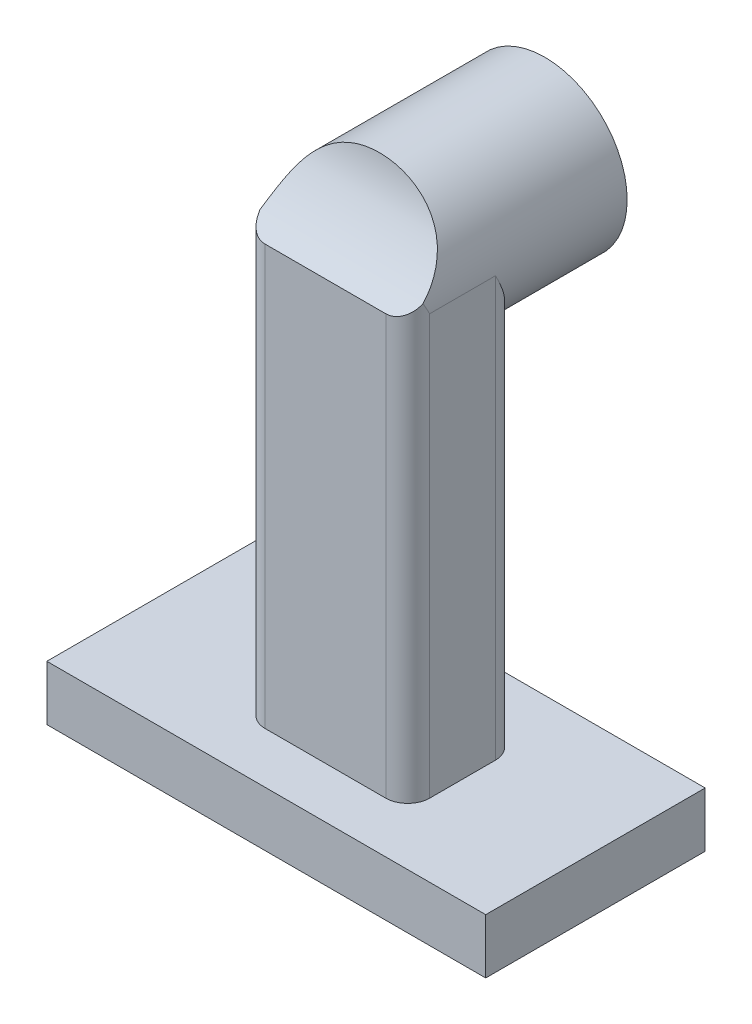
from build123d import *

# Parameters (mm, degrees)
IZIM1_R                          = 7.5
Y_KSEKLIK_EKSTR_ZYON1_DEPTH      = 15
Y_KSEKLIK_EKSTR_ZYON2_DEPTH      = 5
Y_KSEKLIK_EKSTR_ZYON2_DEPTH_BACK = 5
IZIM2_W                          = 15
IZIM2_H                          = 38.236646402
RADYUS1_R                        = 10
RADYUS2_R                        = 2
IZIM3_R                          = 3.5
KES_EKSTR_ZYON1_DEPTH            = 10
IZIM4_W                          = 40
IZIM4_H                          = 20
Y_KSEKLIK_EKSTR_ZYON3_DEPTH      = 5


with BuildPart() as part:
    # Çizim1 → Yükseklik-Ekstrüzyon1 (new body)
    with BuildSketch(Plane.XY):
        with Locations((0, 31.714285714)):
            Circle(IZIM1_R)
    extrude(amount=Y_KSEKLIK_EKSTR_ZYON1_DEPTH)

    # Çizim2 → Yükseklik-Ekstrüzyon2 (add, two sides: drawn at the far end of the back side and taken through both)
    with BuildSketch(Plane.XY.offset(15).offset(-Y_KSEKLIK_EKSTR_ZYON2_DEPTH_BACK)):
        with Locations((0, 12.595962513)):
            Rectangle(IZIM2_W, IZIM2_H)
    extrude(amount=Y_KSEKLIK_EKSTR_ZYON2_DEPTH + Y_KSEKLIK_EKSTR_ZYON2_DEPTH_BACK)

    # Radyus1
    # the kernel refuses this fillet: 10 mm, written as the material it adds along each edge
    with BuildSketch(Plane(origin=(29.150635095, 31.714285714, 15), x_dir=(0, 1, 0), z_dir=(-1, 0, 0))) as radyus1_piece_1_section:
        with BuildLine():
            CenterArc((8.660254038, -10), RADYUS1_R, 90, 60)
            Line((0, -5), (0, 0))
            Line((0, 0), (8.660254038, 0))
        make_face()
    radyus1_piece_1 = extrude(amount=58.301270189, mode=Mode.PRIVATE)
    radyus1_piece_1 = radyus1_piece_1 & Plane(origin=(0, 31.714285714, 15), x_dir=(1, 0, 0), z_dir=(0, 0, -1)) * Cylinder(7.5, 152, mode=Mode.PRIVATE)
    add(radyus1_piece_1)

    # Radyus2
    # the kernel refuses this fillet: 2 mm, written as the material it takes off along each edge
    with BuildSketch(Plane(origin=(-7.5, -11.522360688, 10), x_dir=(0, 0, 1), z_dir=(0, 1, 0))) as radyus2_piece_1_section:
        with BuildLine():
            CenterArc((RADYUS2_R, RADYUS2_R), RADYUS2_R, 180, 90)
            Line((0, RADYUS2_R), (0, 0))
            Line((0, 0), (RADYUS2_R, 0))
        make_face()
    radyus2_piece_1 = extrude(amount=51.736646403, mode=Mode.PRIVATE)
    radyus2_piece_1 = radyus2_piece_1 - Plane(origin=(0, 31.714285714, 10), x_dir=(1, 0, 0), z_dir=(0, 0, -1)) * Cylinder(7.5, 112, mode=Mode.PRIVATE)
    add(radyus2_piece_1, mode=Mode.SUBTRACT)
    with BuildSketch(Plane(origin=(-7.5, -11.522360688, 20), x_dir=(0, 0, -1), z_dir=(0, 1, 0)), Plane(origin=(7.5, 40.214285714, 20), x_dir=(0, 0, -1), z_dir=(0, -1, 0))) as radyus2_piece_2:
        with BuildLine():
            CenterArc((RADYUS2_R, -RADYUS2_R), RADYUS2_R, 90, 90)
            Line((0, -RADYUS2_R), (0, 0))
            Line((0, 0), (RADYUS2_R, 0))
        make_face()
    extrude(amount=51.736646403, mode=Mode.SUBTRACT)
    with BuildSketch(Plane(origin=(7.5, 40.214285714, 10), x_dir=(-1, 0, 0), z_dir=(0, -1, 0))) as radyus2_piece_3_section:
        with BuildLine():
            CenterArc((RADYUS2_R, -RADYUS2_R), RADYUS2_R, 90, 90)
            Line((0, -RADYUS2_R), (0, 0))
            Line((0, 0), (RADYUS2_R, 0))
        make_face()
    radyus2_piece_3 = extrude(amount=51.736646403, mode=Mode.PRIVATE)
    radyus2_piece_3 = radyus2_piece_3 - Plane(origin=(0, 31.714285714, 10), x_dir=(1, 0, 0), z_dir=(0, 0, -1)) * Cylinder(7.5, 112, mode=Mode.PRIVATE)
    add(radyus2_piece_3, mode=Mode.SUBTRACT)

    # Çizim3 → Kes-Ekstrüzyon1 (cut)
    with BuildSketch(Plane(origin=(0, 0, 0), x_dir=(-1, 0, 0), z_dir=(0, 0, -1))):
        with Locations((0, 31.714285714)):
            Circle(IZIM3_R)
    extrude(amount=-KES_EKSTR_ZYON1_DEPTH, mode=Mode.SUBTRACT)

    # Çizim4 → Yükseklik-Ekstrüzyon3 (add)
    with BuildSketch(Plane(origin=(0, -6.522360688, 0), x_dir=(-1, 0, 0), z_dir=(0, -1, 0))):
        with Locations((0.752019729, -14.638510347)):
            Rectangle(IZIM4_W, IZIM4_H)
    extrude(amount=Y_KSEKLIK_EKSTR_ZYON3_DEPTH)


solid = part.part
